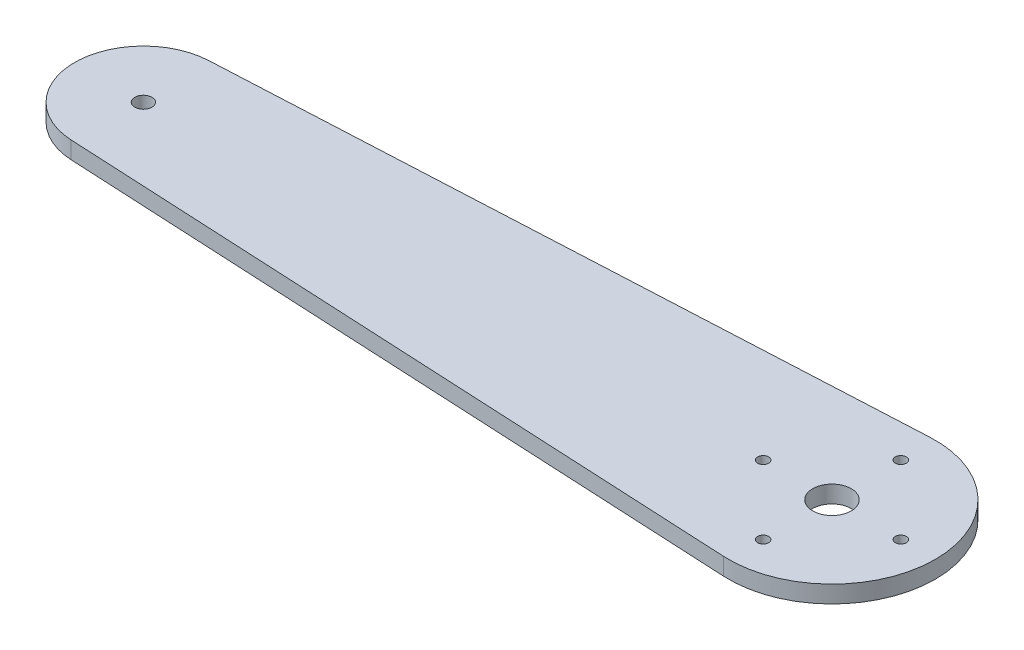
from build123d import *

# Parameters (mm, degrees)
SKETCH1_R           = 1.5875
SKETCH1_R_2         = 3.556
SKETCH1_R_3         = 1.016
BOSS_EXTRUDE1_DEPTH = 3.175


with BuildPart() as part:
    # Sketch1 → Boss-Extrude1 (new body)
    with BuildSketch(Plane(origin=(0, 0, 0), x_dir=(1, 0, 0), z_dir=(0, 1, 0))):
        with BuildLine():
            Line((-127.635, 12.684115066), (-0.9525, 19.026172599))
            ThreePointArc((-0.9525, 19.026172599), (19.05, 0), (-0.9525, -19.026172599))
            Line((-0.9525, -19.026172599), (-127.635, -12.684115066))
            ThreePointArc((-127.635, -12.684115066), (-139.7, 0), (-127.635, 12.684115066))
        make_face()
        with Locations((-127, 0)):
            Circle(SKETCH1_R, mode=Mode.SUBTRACT)
        Circle(SKETCH1_R_2, mode=Mode.SUBTRACT)
        with Locations((0, 12.7)):
            Circle(SKETCH1_R_3, mode=Mode.SUBTRACT)
        with Locations((12.7, 0)):
            Circle(SKETCH1_R_3, mode=Mode.SUBTRACT)
        with Locations((0, -12.7)):
            Circle(SKETCH1_R_3, mode=Mode.SUBTRACT)
        with Locations((-12.7, 0)):
            Circle(SKETCH1_R_3, mode=Mode.SUBTRACT)
    extrude(amount=BOSS_EXTRUDE1_DEPTH)


solid = part.part
